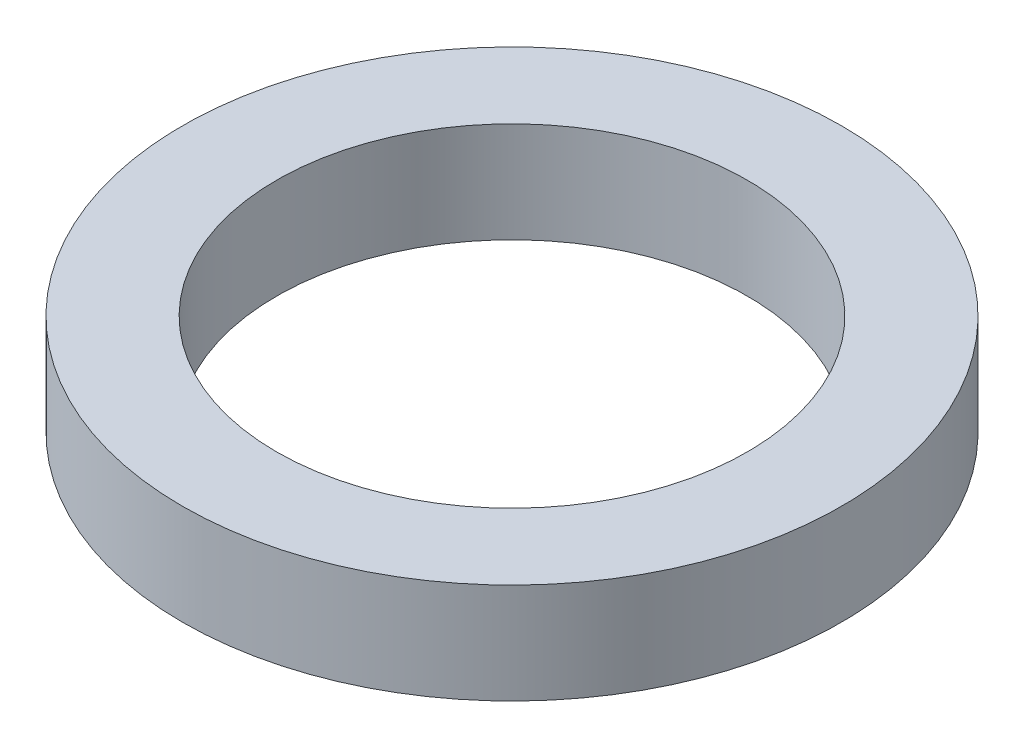
from build123d import *

# Parameters (mm, degrees)
SKETCH1_R           = 52.5
BOSS_EXTRUDE1_DEPTH = 16
SKETCH2_R           = 37.5
CUT_EXTRUDE1_DEPTH  = 76.950641867


with BuildPart() as part:
    # Sketch1 → Boss-Extrude1 (new body)
    with BuildSketch(Plane(origin=(0, 0, 0), x_dir=(1, 0, 0), z_dir=(0, 1, 0))):
        Circle(SKETCH1_R)
    extrude(amount=BOSS_EXTRUDE1_DEPTH)

    # Sketch2 → Cut-Extrude1 (cut, through all)
    with BuildSketch(Plane(origin=(0, 0, 0), x_dir=(1, 0, 0), z_dir=(0, 1, 0))):
        Circle(SKETCH2_R)
    extrude(amount=CUT_EXTRUDE1_DEPTH, mode=Mode.SUBTRACT)


solid = part.part
